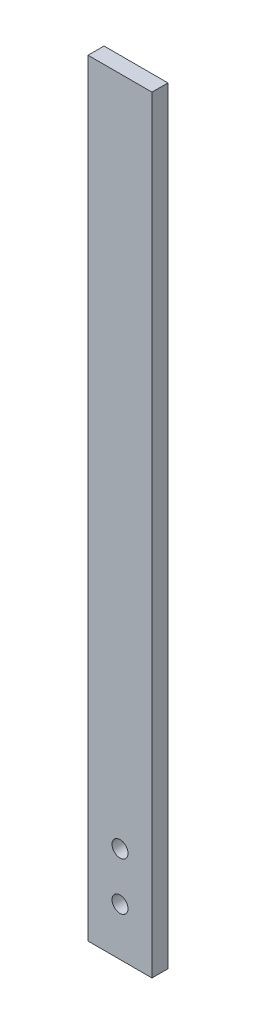
from build123d import *

# Parameters (mm, degrees)
BOSS_EXTRUDE1_DEPTH = 304.8
SKETCH3_R           = 3.175
CUT_EXTRUDE1_DEPTH  = 48.514


with BuildPart() as part:
    # Sketch2 → Boss-Extrude1 (new body)
    with BuildSketch(Plane(origin=(0, 0, 0), x_dir=(1, 0, 0), z_dir=(0, 1, 0))):
        Polygon((0, 1.5875), (0, 0), (20.6375, 0), (25.4, 0), (25.4, 6.35), (0, 6.35), align=None)
    extrude(amount=BOSS_EXTRUDE1_DEPTH)

    # Sketch3 → Cut-Extrude1 (cut)
    with BuildSketch(Plane.XY):
        with Locations((12.7, 19.05)):
            Circle(SKETCH3_R)
        with Locations((12.7, 38.1)):
            Circle(SKETCH3_R)
    extrude(amount=-CUT_EXTRUDE1_DEPTH, mode=Mode.SUBTRACT)


solid = part.part
